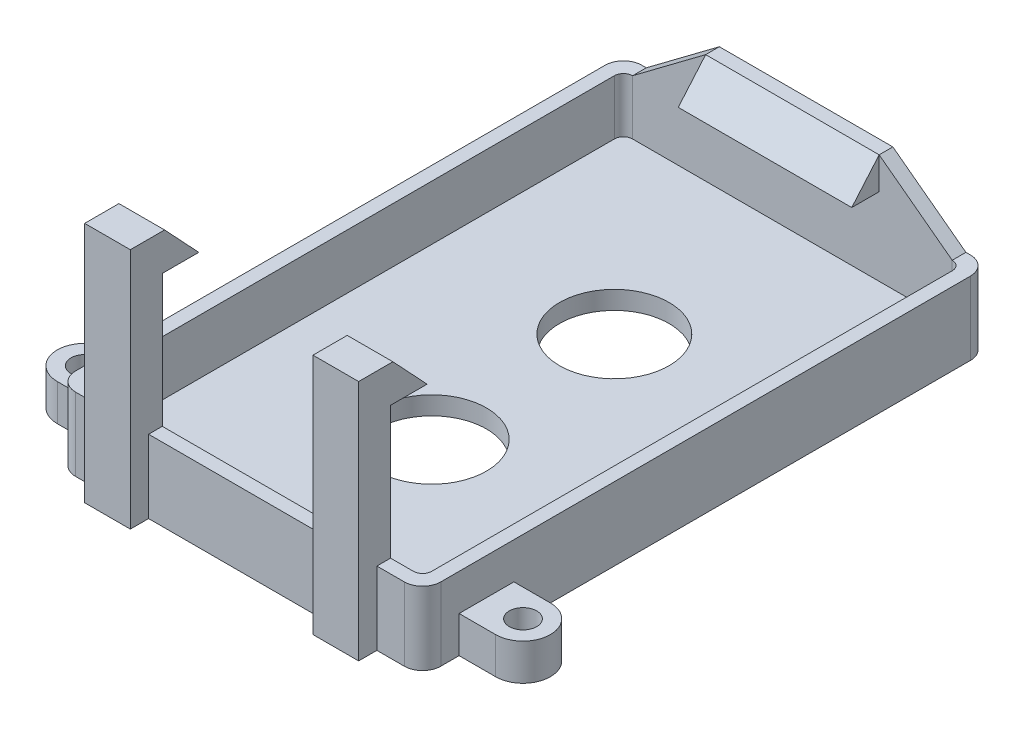
from build123d import *

# Parameters (mm, degrees)
PCB_HOLDER_R             = 0.75
BOSS_EXTRUDE19_DEPTH     = 1
PCB_HOLDER_R_2           = 3
BOSS_EXTRUDE19_2_DEPTH   = 1
BOSS_EXTRUDE20_OUTLINE_R = 0.75
BOSS_EXTRUDE20_DEPTH     = 2
BOSS_EXTRUDE21_DEPTH     = 4
BOSS_EXTRUDE22_DEPTH     = 7
PCB_HOLDER_49_W          = 2.5
PCB_HOLDER_49_H          = 1
PCB_HOLDER_49_H_2        = 0.75
BOSS_EXTRUDE23_DEPTH     = 13.25
SKETCH10_W               = 2.5
SKETCH10_H               = 2
BOSS_EXTRUDE24_DEPTH     = 2
CUT_EXTRUDE9_DEPTH       = 20
CUT_EXTRUDE10_DEPTH      = 20
SKETCH9_W                = 9.5
SKETCH9_H                = 1.75
BOSS_EXTRUDE25_DEPTH     = 1.5
CUT_EXTRUDE11_DEPTH      = 10
CUT_EXTRUDE12_DEPTH      = 10
CUT_EXTRUDE13_DEPTH      = 10


# Read off the part's stored shape, not the designer's step: Boss-Extrude20
with BuildPart() as part:
    # PCB holder → Boss-Extrude19 (new body)
    with BuildSketch(Plane(origin=(0, 0, 0), x_dir=(1, 0, 0), z_dir=(0, 1, 0))):
        with BuildLine():
            Line((-10, -13.5), (-10, -10.5))
            Line((-10, -10.5), (-12, -10.5))
            ThreePointArc((-12, -10.5), (-13.5, -12), (-12, -13.5))
            Line((-12, -13.5), (-10, -13.5))
        make_face()
        with Locations(Location((-12, -12, 0), (0, 0, 270))):
            Circle(PCB_HOLDER_R, mode=Mode.SUBTRACT)
    extrude(amount=BOSS_EXTRUDE19_DEPTH)

    # Boss-Extrude20 outline → Boss-Extrude20 (add)
    with BuildSketch(Plane(origin=(0, 0, 0), x_dir=(1, 0, 0), z_dir=(0, 1, 0))):
        with BuildLine():
            Line((10, -14.5), (10, -13.5))
            Line((10, -13.5), (12, -13.5))
            ThreePointArc((12, -13.5), (13.5, -12), (12, -10.5))
            Line((12, -10.5), (10, -10.5))
            Line((10, -10.5), (10, 14.5))
            ThreePointArc((10, 14.5), (9.707106781, 15.207106781), (9, 15.5))
            Line((9, 15.5), (4.75, 15.5))
            Line((4.75, 15.5), (4.75, 17))
            Line((4.75, 17), (-4.75, 17))
            Line((-4.75, 17), (-4.75, 15.5))
            Line((-4.75, 15.5), (-9, 15.5))
            ThreePointArc((-9, 15.5), (-9.707106781, 15.207106781), (-10, 14.5))
            Line((-10, 14.5), (-10, -10.5))
            Line((-10, -10.5), (-12, -10.5))
            ThreePointArc((-12, -10.5), (-13.5, -12), (-12, -13.5))
            Line((-12, -13.5), (-10, -13.5))
            Line((-10, -13.5), (-10, -14.5))
            ThreePointArc((-10, -14.5), (-9.707106781, -15.207106781), (-9, -15.5))
            Line((-9, -15.5), (9, -15.5))
            ThreePointArc((9, -15.5), (9.707106781, -15.207106781), (10, -14.5))
        make_face()
        with Locations((12, -12)):
            Circle(BOSS_EXTRUDE20_OUTLINE_R, mode=Mode.SUBTRACT)
        with BuildLine():
            Line((-8.75, 14.75), (8.75, 14.75))
            ThreePointArc((8.75, 14.75), (9.103553391, 14.603553391), (9.25, 14.25))
            Line((9.25, 14.25), (9.25, -14.25))
            ThreePointArc((9.25, -14.25), (9.103553391, -14.603553391), (8.75, -14.75))
            Line((8.75, -14.75), (-8.75, -14.75))
            ThreePointArc((-8.75, -14.75), (-9.103553391, -14.603553391), (-9.25, -14.25))
            Line((-9.25, -14.25), (-9.25, 14.25))
            ThreePointArc((-9.25, 14.25), (-9.103553391, 14.603553391), (-8.75, 14.75))
        make_face(mode=Mode.SUBTRACT)
        with Locations((-12, -12)):
            Circle(BOSS_EXTRUDE20_OUTLINE_R, mode=Mode.SUBTRACT)
    extrude(amount=BOSS_EXTRUDE20_DEPTH)



with BuildPart() as body_2:
    # PCB holder → Boss-Extrude19 2 (new body)
    with BuildSketch(Plane(origin=(0, 0, 0), x_dir=(1, 0, 0), z_dir=(0, 1, 0))):
        with BuildLine():
            Line((8.75, 14.75), (-8.75, 14.75))
            ThreePointArc((-8.75, 14.75), (-9.103553391, 14.603553391), (-9.25, 14.25))
            Line((-9.25, 14.25), (-9.25, -14.25))
            ThreePointArc((-9.25, -14.25), (-9.103553391, -14.603553391), (-8.75, -14.75))
            Line((-8.75, -14.75), (7.5, -14.75))
            Line((7.5, -14.75), (7.5, -15.5))
            Line((7.5, -15.5), (9, -15.5))
            ThreePointArc((9, -15.5), (9.707106781, -15.207106781), (10, -14.5))
            Line((10, -14.5), (10, -13.5))
            Line((10, -13.5), (12, -13.5))
            ThreePointArc((12, -13.5), (13.5, -12), (12, -10.5))
            Line((12, -10.5), (10, -10.5))
            Line((10, -10.5), (10, 14.5))
            ThreePointArc((10, 14.5), (9.707106781, 15.207106781), (9, 15.5))
            Line((9, 15.5), (8.75, 15.5))
            Line((8.75, 15.5), (8.75, 14.75))
        make_face()
        with Locations(Location((0, -5, 0), (0, 0, 270))):
            Circle(PCB_HOLDER_R_2, mode=Mode.SUBTRACT)
        with Locations(Location((0, 5, 0), (0, 0, 270))):
            Circle(PCB_HOLDER_R_2, mode=Mode.SUBTRACT)
        with Locations(Location((12, -12, 0), (0, 0, 270))):
            Circle(PCB_HOLDER_R, mode=Mode.SUBTRACT)
    extrude(amount=BOSS_EXTRUDE19_2_DEPTH)

    # PCB holder<47> → Boss-Extrude21 (add)
    with BuildSketch(Plane(origin=(0, 0, 0), x_dir=(1, 0, 0), z_dir=(0, 1, 0))):
        with BuildLine():
            Line((9, 15.5), (-9, 15.5))
            ThreePointArc((-9, 15.5), (-9.707106781, 15.207106781), (-10, 14.5))
            Line((-10, 14.5), (-10, -14.5))
            ThreePointArc((-10, -14.5), (-9.707106781, -15.207106781), (-9, -15.5))
            Line((-9, -15.5), (9, -15.5))
            ThreePointArc((9, -15.5), (9.707106781, -15.207106781), (10, -14.5))
            Line((10, -14.5), (10, 14.5))
            ThreePointArc((10, 14.5), (9.707106781, 15.207106781), (9, 15.5))
        make_face()
        with BuildLine():
            Line((9.25, 14.25), (9.25, -14.25))
            ThreePointArc((9.25, -14.25), (9.103553391, -14.603553391), (8.75, -14.75))
            Line((8.75, -14.75), (-8.75, -14.75))
            ThreePointArc((-8.75, -14.75), (-9.103553391, -14.603553391), (-9.25, -14.25))
            Line((-9.25, -14.25), (-9.25, 14.25))
            ThreePointArc((-9.25, 14.25), (-9.103553391, 14.603553391), (-8.75, 14.75))
            Line((-8.75, 14.75), (8.75, 14.75))
            ThreePointArc((8.75, 14.75), (9.103553391, 14.603553391), (9.25, 14.25))
        make_face(mode=Mode.SUBTRACT)
    extrude(amount=BOSS_EXTRUDE21_DEPTH)

    # PCB holder<48> → Boss-Extrude22 (add)
    with BuildSketch(Plane(origin=(0, 0, 0), x_dir=(1, 0, 0), z_dir=(0, 1, 0))):
        Polygon((-4.75, 15.5), (-8.75, 15.5), (-8.75, 14.75), (8.75, 14.75), (8.75, 15.5), (4.75, 15.5), align=None)
    extrude(amount=BOSS_EXTRUDE22_DEPTH)


with BuildPart() as part_1:
    add(part.part)

    add(body_2.part)  # Boss-Extrude23 merges body 2
    # PCB holder<49> → Boss-Extrude23 (add)
    with BuildSketch(Plane(origin=(0, 0, 0), x_dir=(1, 0, 0), z_dir=(0, 1, 0))):
        with Locations((-6.25, -16)):
            Rectangle(PCB_HOLDER_49_W, PCB_HOLDER_49_H)
        with Locations((6.25, -16)):
            Rectangle(PCB_HOLDER_49_W, PCB_HOLDER_49_H)
        with Locations((-6.25, -15.125)):
            Rectangle(PCB_HOLDER_49_W, PCB_HOLDER_49_H_2)
        with Locations((6.25, -15.125)):
            Rectangle(PCB_HOLDER_49_W, PCB_HOLDER_49_H_2)
    extrude(amount=BOSS_EXTRUDE23_DEPTH)

    # Sketch10 → Boss-Extrude24 (add)
    with BuildSketch(Plane(origin=(0, 0, 14.75), x_dir=(-1, 0, 0), z_dir=(0, 0, -1))):
        with Locations((-6.25, 12.25)):
            Rectangle(SKETCH10_W, SKETCH10_H)
        with Locations((6.25, 12.25)):
            Rectangle(SKETCH10_W, SKETCH10_H)
    extrude(amount=BOSS_EXTRUDE24_DEPTH)

    # Sketch11 → Cut-Extrude9 (cut)
    with BuildSketch(Plane(origin=(7.5, 0, 0), x_dir=(0, 0, -1), z_dir=(1, 0, 0))):
        Polygon((-12.75, 11.25), (-14.625, 13.25), (-12.75, 13.25), align=None)
    extrude(amount=-CUT_EXTRUDE9_DEPTH, mode=Mode.SUBTRACT)

    # Sketch12 → Cut-Extrude10 (cut)
    with BuildSketch(Plane.ZY.offset(4.75)):
        Polygon((-15.5, 0), (-17, 2), (-17, 0), align=None)
    extrude(amount=-CUT_EXTRUDE10_DEPTH, mode=Mode.SUBTRACT)

    # Sketch9 → Boss-Extrude25 (add)
    with BuildSketch(Plane.XY.offset(-14.75)):
        with Locations((0, 6.125)):
            Rectangle(SKETCH9_W, SKETCH9_H)
    extrude(amount=BOSS_EXTRUDE25_DEPTH)

    # Sketch15 → Cut-Extrude11 (cut)
    with BuildSketch(Plane.ZY.offset(4.75)):
        Polygon((-14.75, 7), (-13.25, 5.25), (-13.25, 7), align=None)
    extrude(amount=-CUT_EXTRUDE11_DEPTH, mode=Mode.SUBTRACT)

    # Sketch16 → Cut-Extrude12 (cut)
    with BuildSketch(Plane.XY.offset(-14.75)):
        Polygon((8.75, 4), (4.75, 7), (8.75, 7), align=None)
    extrude(amount=-CUT_EXTRUDE12_DEPTH, mode=Mode.SUBTRACT)

    # Sketch17 → Cut-Extrude13 (cut)
    with BuildSketch(Plane.XY.offset(-14.75)):
        Polygon((-8.75, 4), (-4.75, 7), (-8.75, 7), align=None)
    extrude(amount=-CUT_EXTRUDE13_DEPTH, mode=Mode.SUBTRACT)


solid = part_1.part
